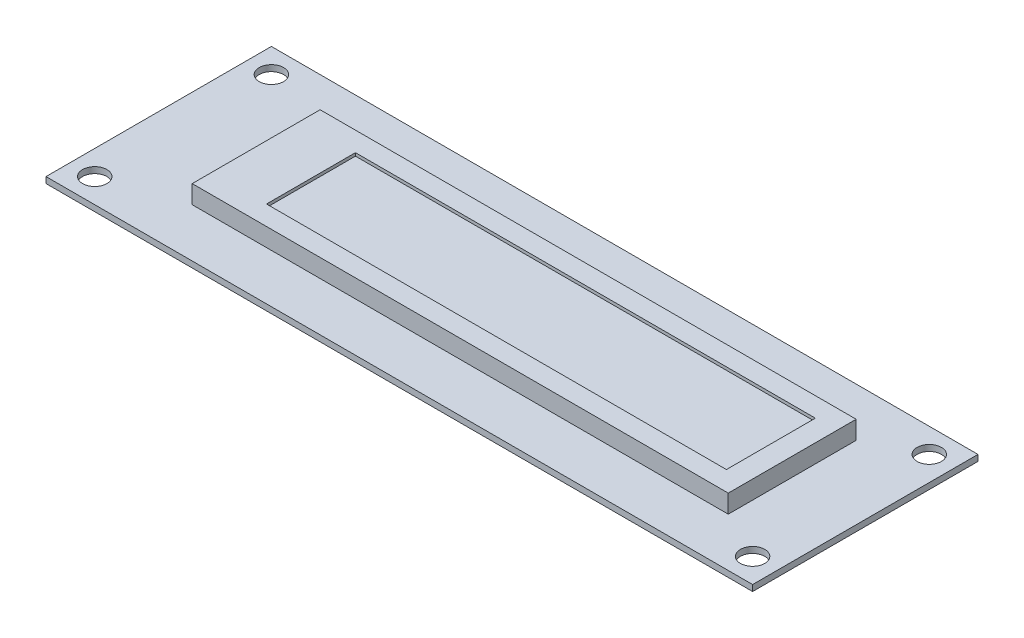
from build123d import *

# Parameters (mm, degrees)
SKETCH1_W               = 116
SKETCH1_H               = 37
BOSS_EXTRUDE1_DEPTH     = 1
SKETCH2_W               = 88
SKETCH2_H               = 21
BOSS_EXTRUDE2_DEPTH     = 3
SKETCH3_W               = 75.5
SKETCH3_H               = 14.6
CUT_EXTRUDE1_DEPTH      = 0.5
SKETCH4_R               = 2
CUT_EXTRUDE2_DEPTH      = 10
MIRROR2_COPY_1_SKETCH_R = 2
MIRROR2_COPY_1_DEPTH    = 10
MIRROR2_COPY_2_SKETCH_R = 2
MIRROR2_COPY_2_DEPTH    = 10


with BuildPart() as part:
    # Sketch1 → Boss-Extrude1 (new body)
    with BuildSketch(Plane(origin=(0, 0, 0), x_dir=(1, 0, 0), z_dir=(0, 1, 0))):
        Rectangle(SKETCH1_W, SKETCH1_H)
    extrude(amount=BOSS_EXTRUDE1_DEPTH)

    # Sketch2 → Boss-Extrude2 (add)
    with BuildSketch(Plane(origin=(0, 1, 0), x_dir=(1, 0, 0), z_dir=(0, 1, 0))):
        with Locations((2, 0)):
            Rectangle(SKETCH2_W, SKETCH2_H)
    extrude(amount=BOSS_EXTRUDE2_DEPTH)

    # Sketch3 → Cut-Extrude1 (cut)
    with BuildSketch(Plane(origin=(0, 4, 0), x_dir=(1, 0, 0), z_dir=(0, 1, 0))):
        with Locations((4.75, 0)):
            Rectangle(SKETCH3_W, SKETCH3_H)
    extrude(amount=-CUT_EXTRUDE1_DEPTH, mode=Mode.SUBTRACT)

    # Sketch4 → Cut-Extrude2 (cut)
    with BuildSketch(Plane(origin=(0, 1, 0), x_dir=(1, 0, 0), z_dir=(0, 1, 0))):
        with Locations((54, -14.5)):
            Circle(SKETCH4_R)
    cut_extrude2 = extrude(amount=-CUT_EXTRUDE2_DEPTH, mode=Mode.SUBTRACT)

    # Mirror1: Cut-Extrude2 across plane
    add(cut_extrude2.mirror(Plane(origin=(0, 0, 0), x_dir=(0, 0, 1), z_dir=(1, 0, 0))), mode=Mode.SUBTRACT)

    # Mirror2 copy 1 sketch → Mirror2 copy 1 (cut)
    with BuildSketch(Plane(origin=(0, 1, 0), x_dir=(-1, 0, 0), z_dir=(0, 1, 0))):
        with Locations((54, -14.5)):
            Circle(MIRROR2_COPY_1_SKETCH_R)
    extrude(amount=-MIRROR2_COPY_1_DEPTH, mode=Mode.SUBTRACT)

    # Mirror2 copy 2 sketch → Mirror2 copy 2 (cut)
    with BuildSketch(Plane(origin=(0, 1, 0), x_dir=(1, 0, 0), z_dir=(0, 1, 0))):
        with Locations((54, 14.5)):
            Circle(MIRROR2_COPY_2_SKETCH_R)
    extrude(amount=-MIRROR2_COPY_2_DEPTH, mode=Mode.SUBTRACT)


solid = part.part
